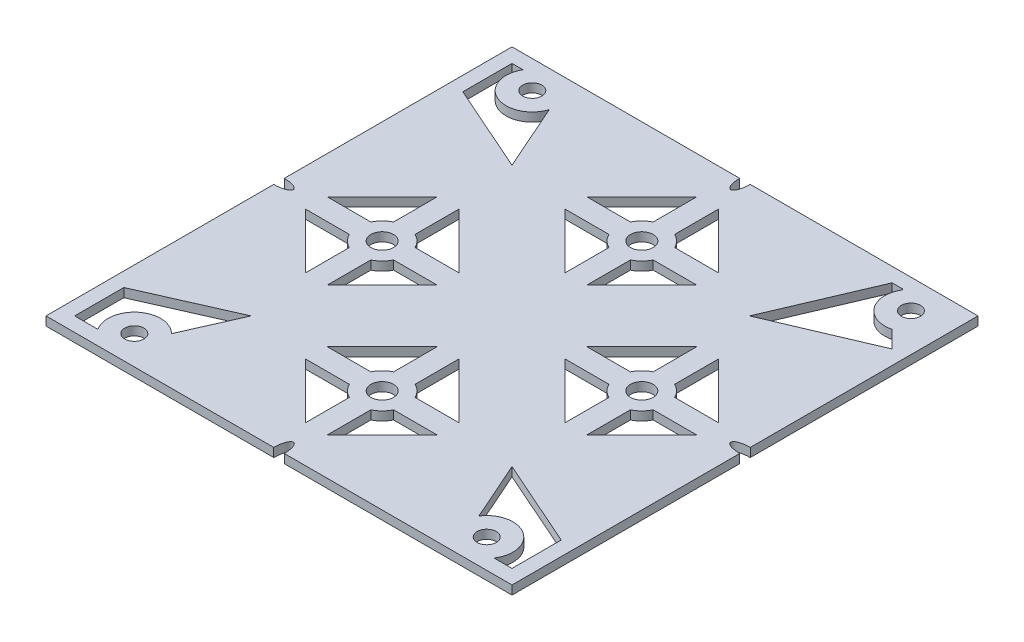
from build123d import *

# Parameters (mm, degrees)
SKETCH1_W           = 97.6
SKETCH1_H           = 97.6
BOSS_EXTRUDE1_DEPTH = 1.85
SKETCH3_R           = 1.25
CUT_EXTRUDE1_DEPTH  = 10
FILLET1_R           = 0.2
SKETCH5_R           = 2.375
CUT_EXTRUDE2_DEPTH  = 10
SKETCH6_R           = 2
CUT_EXTRUDE3_DEPTH  = 139.039641188


with BuildPart() as part:
    # Sketch1 → Boss-Extrude1 (new body)
    with BuildSketch(Plane(origin=(0, 0, 0), x_dir=(1, 0, 0), z_dir=(0, 1, 0))):
        with Locations((48.8, 48.8)):
            Rectangle(SKETCH1_W, SKETCH1_H)
    extrude(amount=BOSS_EXTRUDE1_DEPTH)

    # Sketch3 → Cut-Extrude1 (cut)
    with BuildSketch(Plane.XZ):
        with BuildLine():
            Line((3, -84.3), (3, -94.6))
            Line((3, -94.6), (5.316079849, -94.6))
            ThreePointArc((5.316079849, -94.6), (7.792729855, -86.784550719), (15.285000001, -90.113353923))
            Line((15.285000001, -90.113353923), (21.472818771, -76.127181229))
            Line((21.472818771, -76.127181229), (3, -84.3))
        make_face()
        with BuildLine():
            Line((3, -13.3), (21.472818771, -21.472818771))
            Line((21.472818771, -21.472818771), (16.360495139, -9.917560959))
            ThreePointArc((16.360495139, -9.917560959), (8.975209709, -10.313312378), (7.873156109, -3))
            Line((7.873156109, -3), (3, -3))
            Line((3, -3), (3, -13.3))
        make_face()
        with BuildLine():
            Line((94.6, -13.3), (94.6, -3))
            Line((94.6, -3), (90.826843891, -3))
            ThreePointArc((90.826843891, -3), (89.267333256, -10.648445392), (81.630186258, -9.034513526))
            Line((81.630186258, -9.034513526), (76.127181229, -21.472818771))
            Line((76.127181229, -21.472818771), (94.6, -13.3))
        make_face()
        with BuildLine():
            Line((91.027327292, -86.172672708), (94.6, -82.6))
            Line((94.6, -82.6), (73.674141566, -73.674141566))
            Line((73.674141566, -73.674141566), (82.6, -94.6))
            Line((82.6, -94.6), (85.116873323, -94.6))
            ThreePointArc((85.116873323, -94.6), (85.157069093, -88.341897208), (91.027327292, -86.172672708))
        make_face()
        with Locations((89.66, -91.5)):
            Circle(SKETCH3_R)
        with Locations((10.05, -91.8)):
            Circle(SKETCH3_R)
        with Locations((12.45, -6.05)):
            Circle(SKETCH3_R)
        with Locations((86.25, -6.05)):
            Circle(SKETCH3_R)
    extrude(amount=-CUT_EXTRUDE1_DEPTH, mode=Mode.SUBTRACT)

    # Fillet1
    fillet1_edges = [part.edges().sort_by_distance(p)[0] for p in [
        (85.116873323, 0.925, -94.6),
    ]]
    fillet(fillet1_edges, radius=FILLET1_R)

    # Sketch5 → Cut-Extrude2 (cut)
    with BuildSketch(Plane.XZ):
        with BuildLine():
            Line((51.05, -80.617052601), (51.05, -89.767052601))
            Line((51.05, -89.767052601), (62.582493929, -78.234558673))
            Line((62.582493929, -78.234558673), (53.432493929, -78.234558673))
            ThreePointArc((53.432493929, -78.234558673), (52.441599923, -79.626158596), (51.05, -80.617052601))
        make_face()
        with BuildLine():
            Line((46.55, -89.767052601), (46.55, -80.617052601))
            ThreePointArc((46.55, -80.617052601), (45.158400077, -79.626158596), (44.167506071, -78.234558673))
            Line((44.167506071, -78.234558673), (35.017506071, -78.234558673))
            Line((35.017506071, -78.234558673), (46.55, -89.767052601))
        make_face()
        with BuildLine():
            Line((35.017506071, -73.734558673), (44.167506071, -73.734558673))
            ThreePointArc((44.167506071, -73.734558673), (45.158400077, -72.34295875), (46.55, -71.352064744))
            Line((46.55, -71.352064744), (46.55, -62.202064744))
            Line((46.55, -62.202064744), (35.017506071, -73.734558673))
        make_face()
        with BuildLine():
            ThreePointArc((51.05, -71.352064744), (52.441599923, -72.34295875), (53.432493929, -73.734558673))
            Line((53.432493929, -73.734558673), (62.582493929, -73.734558673))
            Line((62.582493929, -73.734558673), (51.05, -62.202064744))
            Line((51.05, -62.202064744), (51.05, -71.352064744))
        make_face()
        with BuildLine():
            Line((73.734558673, -35.017506071), (62.202064744, -46.55))
            Line((62.202064744, -46.55), (71.352064744, -46.55))
            ThreePointArc((71.352064744, -46.55), (72.34295875, -45.158400077), (73.734558673, -44.167506071))
            Line((73.734558673, -44.167506071), (73.734558673, -35.017506071))
        make_face()
        with BuildLine():
            ThreePointArc((73.734558673, -53.432493929), (72.34295875, -52.441599923), (71.352064744, -51.05))
            Line((71.352064744, -51.05), (62.202064744, -51.05))
            Line((62.202064744, -51.05), (73.734558673, -62.582493929))
            Line((73.734558673, -62.582493929), (73.734558673, -53.432493929))
        make_face()
        with BuildLine():
            Line((78.234558673, -35.017506071), (78.234558673, -44.167506071))
            ThreePointArc((78.234558673, -44.167506071), (79.626158596, -45.158400077), (80.617052601, -46.55))
            Line((80.617052601, -46.55), (89.767052601, -46.55))
            Line((89.767052601, -46.55), (78.234558673, -35.017506071))
        make_face()
        with BuildLine():
            ThreePointArc((80.617052601, -51.05), (79.626158596, -52.441599923), (78.234558673, -53.432493929))
            Line((78.234558673, -53.432493929), (78.234558673, -62.582493929))
            Line((78.234558673, -62.582493929), (89.767052601, -51.05))
            Line((89.767052601, -51.05), (80.617052601, -51.05))
        make_face()
        with BuildLine():
            Line((46.55, -16.982947399), (46.55, -7.832947399))
            Line((46.55, -7.832947399), (35.017506071, -19.365441327))
            Line((35.017506071, -19.365441327), (44.167506071, -19.365441327))
            ThreePointArc((44.167506071, -19.365441327), (45.158400077, -17.973841404), (46.55, -16.982947399))
        make_face()
        with BuildLine():
            Line((51.05, -7.832947399), (51.05, -16.982947399))
            ThreePointArc((51.05, -16.982947399), (52.441599923, -17.973841404), (53.432493929, -19.365441327))
            Line((53.432493929, -19.365441327), (62.582493929, -19.365441327))
            Line((62.582493929, -19.365441327), (51.05, -7.832947399))
        make_face()
        with BuildLine():
            ThreePointArc((46.55, -26.247935256), (45.158400077, -25.25704125), (44.167506071, -23.865441327))
            Line((44.167506071, -23.865441327), (35.017506071, -23.865441327))
            Line((35.017506071, -23.865441327), (46.55, -35.397935256))
            Line((46.55, -35.397935256), (46.55, -26.247935256))
        make_face()
        with BuildLine():
            Line((62.582493929, -23.865441327), (53.432493929, -23.865441327))
            ThreePointArc((53.432493929, -23.865441327), (52.441599923, -25.25704125), (51.05, -26.247935256))
            Line((51.05, -26.247935256), (51.05, -35.397935256))
            Line((51.05, -35.397935256), (62.582493929, -23.865441327))
        make_face()
        with BuildLine():
            Line((23.865441327, -62.582493929), (35.397935256, -51.05))
            Line((35.397935256, -51.05), (26.247935256, -51.05))
            ThreePointArc((26.247935256, -51.05), (25.25704125, -52.441599923), (23.865441327, -53.432493929))
            Line((23.865441327, -53.432493929), (23.865441327, -62.582493929))
        make_face()
        with BuildLine():
            Line((19.365441327, -62.582493929), (19.365441327, -53.432493929))
            ThreePointArc((19.365441327, -53.432493929), (17.973841404, -52.441599923), (16.982947399, -51.05))
            Line((16.982947399, -51.05), (7.832947399, -51.05))
            Line((7.832947399, -51.05), (19.365441327, -62.582493929))
        make_face()
        with BuildLine():
            ThreePointArc((23.865441327, -44.167506071), (25.25704125, -45.158400077), (26.247935256, -46.55))
            Line((26.247935256, -46.55), (35.397935256, -46.55))
            Line((35.397935256, -46.55), (23.865441327, -35.017506071))
            Line((23.865441327, -35.017506071), (23.865441327, -44.167506071))
        make_face()
        with BuildLine():
            Line((7.832947399, -46.55), (16.982947399, -46.55))
            ThreePointArc((16.982947399, -46.55), (17.973841404, -45.158400077), (19.365441327, -44.167506071))
            Line((19.365441327, -44.167506071), (19.365441327, -35.017506071))
            Line((19.365441327, -35.017506071), (7.832947399, -46.55))
        make_face()
        with BuildLine():
            Line((47.7, -97.6), (49.9, -97.6))
            add(Edge.make_bspline(
                [(49.9, -97.6), (49.9, -94.604595373), (48.8, -94.604595373)],
                knots=[4.71238898, 4.71238898, 4.71238898, 6.283185307, 6.283185307, 6.283185307], degree=2, weights=[1, 0.707106781, 1]))
            add(Edge.make_bspline(
                [(48.8, -94.604595373), (47.7, -94.604595373), (47.7, -97.6)],
                knots=[0, 0, 0, 1.570796327, 1.570796327, 1.570796327], degree=2, weights=[1, 0.707106781, 1]))
        make_face()
        with BuildLine():
            add(Edge.make_bspline(
                [(94.596161078, -48.8), (94.596161078, -49.9), (97.6, -49.9)],
                knots=[0, 0, 0, 1.570796327, 1.570796327, 1.570796327], degree=2, weights=[1, 0.707106781, 1]))
            Line((97.6, -49.9), (97.6, -47.7))
            add(Edge.make_bspline(
                [(97.6, -47.7), (94.596161078, -47.7), (94.596161078, -48.8)],
                knots=[4.71238898, 4.71238898, 4.71238898, 6.283185307, 6.283185307, 6.283185307], degree=2, weights=[1, 0.707106781, 1]))
        make_face()
        with BuildLine():
            Line((0, -47.7), (0, -49.9))
            add(Edge.make_bspline(
                [(0, -49.9), (3, -49.9), (3, -48.8)],
                knots=[4.71238898, 4.71238898, 4.71238898, 6.283185307, 6.283185307, 6.283185307], degree=2, weights=[1, 0.707106781, 1]))
            add(Edge.make_bspline(
                [(3, -48.8), (3, -47.7), (0, -47.7)],
                knots=[0, 0, 0, 1.570796327, 1.570796327, 1.570796327], degree=2, weights=[1, 0.707106781, 1]))
        make_face()
        with BuildLine():
            add(Edge.make_bspline(
                [(48.8, -3), (49.9, -3), (49.9, 0)],
                knots=[0, 0, 0, 1.570796327, 1.570796327, 1.570796327], degree=2, weights=[1, 0.707106781, 1]))
            Line((49.9, 0), (47.7, 0))
            add(Edge.make_bspline(
                [(47.7, 0), (47.7, -3), (48.8, -3)],
                knots=[4.71238898, 4.71238898, 4.71238898, 6.283185307, 6.283185307, 6.283185307], degree=2, weights=[1, 0.707106781, 1]))
        make_face()
        with Locations((48.8, -75.984558673)):
            Circle(SKETCH5_R)
        with Locations((75.984558673, -48.8)):
            Circle(SKETCH5_R)
        with Locations((48.8, -21.615441327)):
            Circle(SKETCH5_R)
        with Locations((21.615441327, -48.8)):
            Circle(SKETCH5_R)
    extrude(amount=-CUT_EXTRUDE2_DEPTH, mode=Mode.SUBTRACT)

    # Sketch6 → Cut-Extrude3 (cut, through all)
    with BuildSketch(Plane.XZ):
        with Locations((12.45, -6.05)):
            Circle(SKETCH6_R)
        with Locations((86.25, -6.05)):
            Circle(SKETCH6_R)
        with Locations((10.05, -91.8)):
            Circle(SKETCH6_R)
        with Locations((89.66, -91.5)):
            Circle(SKETCH6_R)
    extrude(amount=-CUT_EXTRUDE3_DEPTH, mode=Mode.SUBTRACT)


solid = part.part
